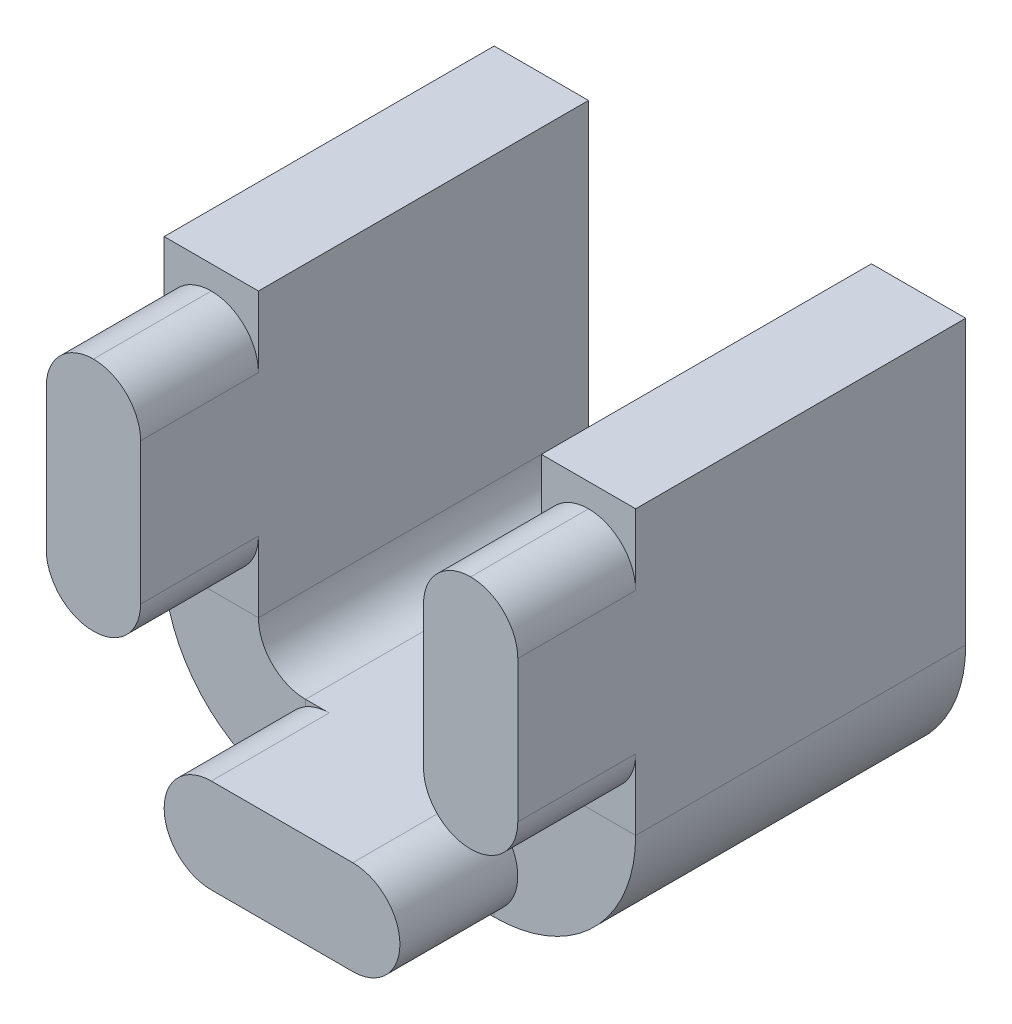
from build123d import *

# Parameters (mm, degrees)
EXTRU_MINCE1_DEPTH      = 3.5
D_PLIAGE_START          = -3.5
D_PLIAGE_2_OUTLINE_W    = 2
D_PLIAGE_2_OUTLINE_H    = 7
D_PLIAGE_2_DEPTH        = 7
D_PLIAGE_2_2_OUTLINE_W  = 6.141592654
D_PLIAGE_2_2_OUTLINE_H  = 2
D_PLIAGE_2_2_DEPTH      = 7
PLIAGE_START            = -3.5
PLIAGE_2_DEPTH          = 7
PLIAGE_2_2_DEPTH        = 7
ENL_V_MAT_EXTRU_1_REACH = 11.287
ESQUISSE10_R            = 1.5
ESQUISSE11_W            = 2.5
ESQUISSE11_H            = 5
PATTE1_DEPTH            = 2
CONG_2_R                = 1
ESQUISSE13_W            = 2.5
ESQUISSE13_H            = 5
PATTE2_DEPTH            = 2
CONG_9_R                = 1
EXTRUSION2_DEPTH        = 2.5
EXTRU_MINCE2_START      = 1
ESQUISSE16_R            = 1.75
ESQUISSE16_R_2          = 1.5
EXTRU_MINCE2_DEPTH      = 1


# Read off the part's stored shape, not the designer's step: Dépliage 2, Pliage 2
# Sheet-metal steps are written as plain solids
with BuildPart() as part:
    # Esquisse1 → Extru.-Mince1 (new, symmetric)
    with BuildSketch(Plane.XY):
        Polygon((-3, 7), (-3, 0), (3, 0), (3, 7), (5, 7), (5, -2), (-5, -2), (-5, 7), align=None)
    extrude(amount=EXTRU_MINCE1_DEPTH, both=True)

    # Dépliage 2 outline → Dépliage 2 (cut)
    with BuildSketch(Plane.XY.offset(D_PLIAGE_START)):
        with Locations((4, 3.5)):
            Rectangle(D_PLIAGE_2_OUTLINE_W, D_PLIAGE_2_OUTLINE_H)
        with Locations((-4, 3.5)):
            Rectangle(D_PLIAGE_2_OUTLINE_W, D_PLIAGE_2_OUTLINE_H)
    extrude(amount=D_PLIAGE_2_DEPTH, mode=Mode.SUBTRACT)

    # D_pliage 2 2 outline → D_pliage 2 2 (add)
    with BuildSketch(Plane.XY.offset(D_PLIAGE_START)):
        with Locations((8.070796327, -1)):
            Rectangle(D_PLIAGE_2_2_OUTLINE_W, D_PLIAGE_2_2_OUTLINE_H)
        with Locations((-8.070796327, -1)):
            Rectangle(D_PLIAGE_2_2_OUTLINE_W, D_PLIAGE_2_2_OUTLINE_H)
    extrude(amount=D_PLIAGE_2_2_DEPTH)

    # Pliage 2 outline → Pliage 2 (cut)
    with BuildSketch(Plane.XY.offset(PLIAGE_START)):
        with BuildLine():
            ThreePointArc((-2, -2), (-3.732050808, -1.449489743), (-4.828427125, 0))
            Line((-4.828427125, 0), (-11.141592654, 0))
            Line((-11.141592654, 0), (-11.141592654, -2))
            Line((-11.141592654, -2), (-2, -2))
        make_face()
        with BuildLine():
            Line((11.141592654, 0), (4.828427125, 0))
            ThreePointArc((4.828427125, 0), (3.732050808, -1.449489743), (2, -2))
            Line((2, -2), (11.141592654, -2))
            Line((11.141592654, -2), (11.141592654, 0))
        make_face()
    extrude(amount=PLIAGE_2_DEPTH, mode=Mode.SUBTRACT)

    # Pliage 2 2 outline → Pliage 2 2 (add)
    with BuildSketch(Plane.XY.offset(PLIAGE_START)):
        with BuildLine():
            Line((-3, 1), (-3, 7))
            Line((-3, 7), (-5, 7))
            Line((-5, 7), (-5, 1))
            ThreePointArc((-5, 1), (-4.956795679, 0.492694064), (-4.828427125, 0))
            Line((-4.828427125, 0), (-2, 0))
            ThreePointArc((-2, 0), (-2.707106781, 0.292893219), (-3, 1))
        make_face()
        with BuildLine():
            Line((5, 7), (3, 7))
            Line((3, 7), (3, 1))
            ThreePointArc((3, 1), (2.707106781, 0.292893219), (2, 0))
            Line((2, 0), (4.828427125, 0))
            ThreePointArc((4.828427125, 0), (4.956795679, 0.492694064), (5, 1))
            Line((5, 1), (5, 7))
        make_face()
    extrude(amount=PLIAGE_2_2_DEPTH)

    # Esquisse10 → Enlèv. mat.-Extru.1 (cut, up to next)
    with BuildSketch(Plane(origin=(0, 0, 0), x_dir=(1, 0, 0), z_dir=(0, 1, 0)), mode=Mode.PRIVATE) as enl_v_mat_extru_1_sk1:
        with Locations(Location((0, 0, 0), (0, 0, 90))):
            Circle(ESQUISSE10_R)
    enl_v_mat_extru_1_tool1 = extrude(enl_v_mat_extru_1_sk1.sketch, amount=-ENL_V_MAT_EXTRU_1_REACH, mode=Mode.PRIVATE) & part.part
    add(enl_v_mat_extru_1_tool1.solids().sort_by_distance((0, 0, 0))[0], mode=Mode.SUBTRACT)

    # Esquisse11 → Patte1 (add)
    with BuildSketch(Plane.ZY.offset(5)):
        with Locations((4.75, 4)):
            Rectangle(ESQUISSE11_W, ESQUISSE11_H)
    extrude(amount=-PATTE1_DEPTH)

    # Congé2
    cong_2_edges = [part.edges().sort_by_distance(p)[0] for p in [
        (-5, 6.5, 4.75),
        (-3, 6.5, 4.75),
        (-5, 1.5, 4.75),
        (-3, 1.5, 4.75),
    ]]
    fillet(cong_2_edges, radius=CONG_2_R - 0.0001)  # a hair under: the kernel refuses the full size

    # Esquisse13 → Patte2 (add)
    with BuildSketch(Plane(origin=(5, 0, 0), x_dir=(0, 0, -1), z_dir=(1, 0, 0))):
        with Locations((-4.75, 4)):
            Rectangle(ESQUISSE13_W, ESQUISSE13_H)
    extrude(amount=-PATTE2_DEPTH)

    # Congé9
    cong_9_edges = [part.edges().sort_by_distance(p)[0] for p in [
        (5, 6.5, 4.75),
        (3, 6.5, 4.75),
        (5, 1.5, 4.75),
        (3, 1.5, 4.75),
    ]]
    fillet(cong_9_edges, radius=CONG_9_R - 0.0001)  # a hair under: the kernel refuses the full size

    # Esquisse15 → Extrusion2 (add)
    with BuildSketch(Plane.XY.offset(3.5)):
        with BuildLine():
            Line((1.5, 0), (-1.5, 0))
            ThreePointArc((-1.5, 0), (-2.5, -1), (-1.5, -2))
            Line((-1.5, -2), (1.5, -2))
            ThreePointArc((1.5, -2), (2.5, -1), (1.5, 0))
        make_face()
    extrude(amount=EXTRUSION2_DEPTH)

    # Esquisse16 → Extru.-Mince2 (add)
    with BuildSketch(Plane(origin=(0, 0, 0), x_dir=(1, 0, 0), z_dir=(0, 1, 0)).offset(EXTRU_MINCE2_START)):
        Circle(ESQUISSE16_R)
        Circle(ESQUISSE16_R_2, mode=Mode.SUBTRACT)
    extrude(amount=-EXTRU_MINCE2_DEPTH)


solid = part.part
